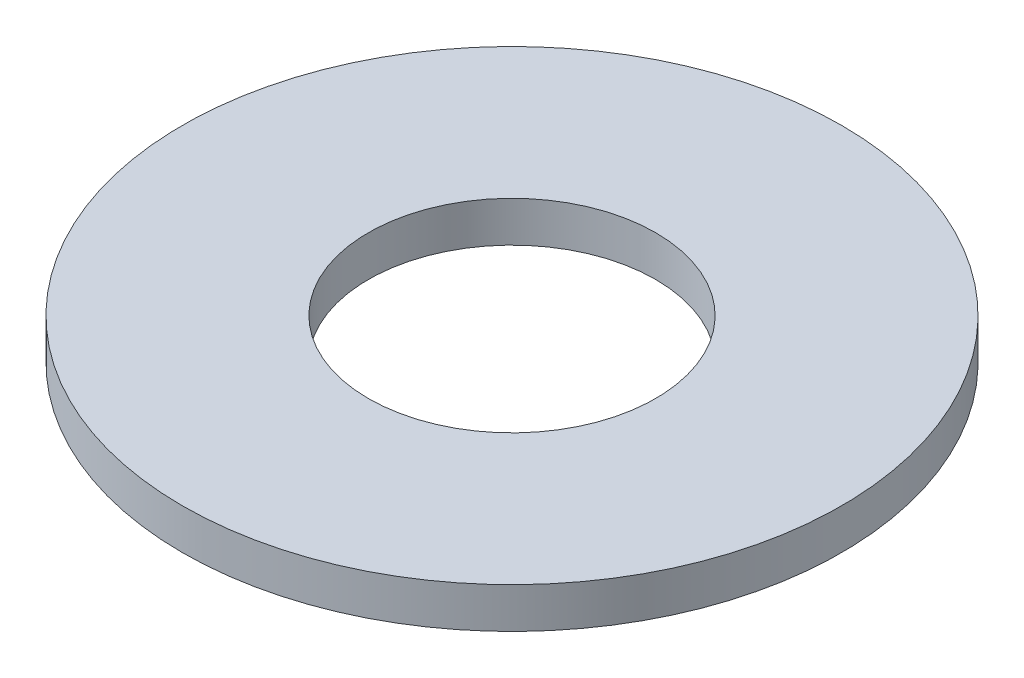
from build123d import *

# Parameters (mm, degrees)
SKETCH1_R           = 97.5
BOSS_EXTRUDE1_DEPTH = 12
SKETCH2_R           = 42.5
CUT_EXTRUDE1_DEPTH  = 139.407008493


with BuildPart() as part:
    # Sketch1 → Boss-Extrude1 (new body)
    with BuildSketch(Plane(origin=(0, 0, 0), x_dir=(1, 0, 0), z_dir=(0, 1, 0))):
        Circle(SKETCH1_R)
    extrude(amount=BOSS_EXTRUDE1_DEPTH)

    # Sketch2 → Cut-Extrude1 (cut, through all)
    with BuildSketch(Plane(origin=(0, 0, 0), x_dir=(1, 0, 0), z_dir=(0, 1, 0))):
        Circle(SKETCH2_R)
    extrude(amount=CUT_EXTRUDE1_DEPTH, mode=Mode.SUBTRACT)


solid = part.part
